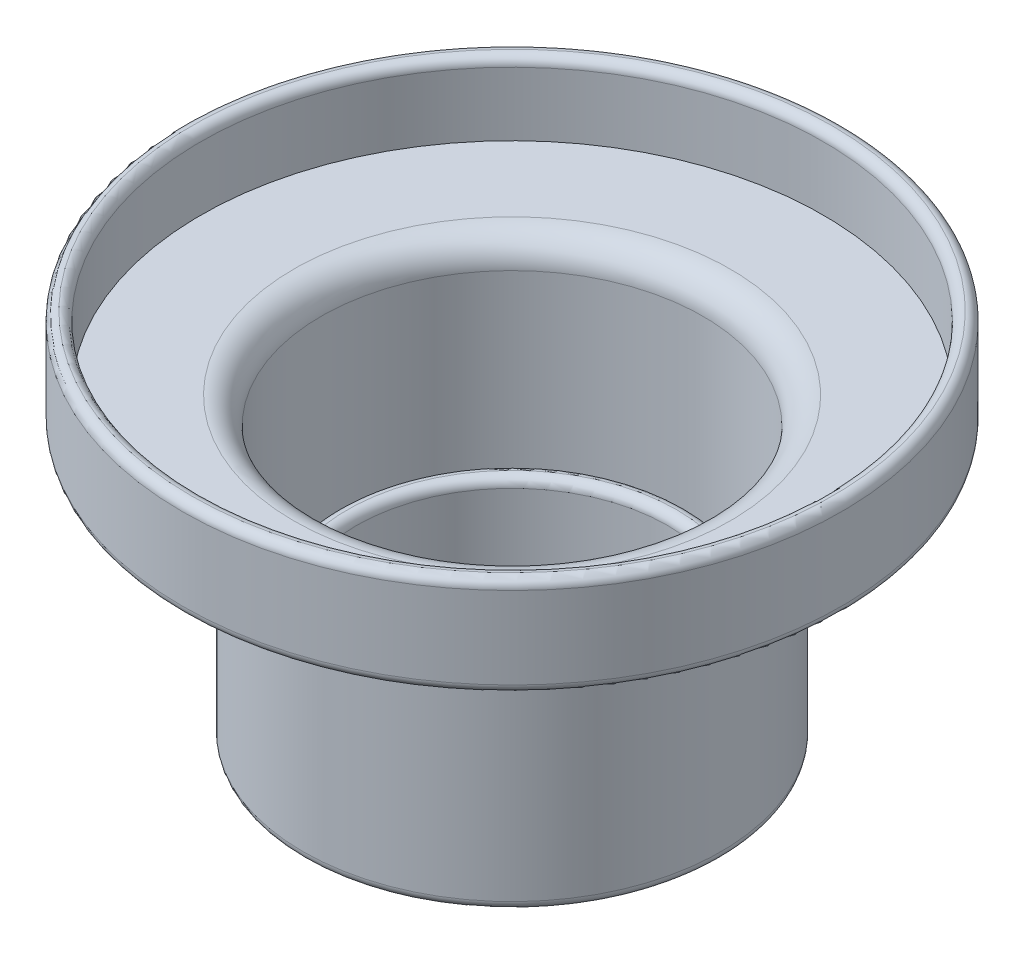
from build123d import *

# Parameters (mm, degrees)
SKETCH1_R           = 19.125
SKETCH1_R_2         = 17.125
BOSS_EXTRUDE1_DEPTH = 10
SKETCH2_R           = 23
SKETCH2_R_2         = 21
BOSS_EXTRUDE2_DEPTH = 30
BOSS_EXTRUDE3_START = -3
SKETCH3_R           = 23
SKETCH3_R_2         = 17.125
BOSS_EXTRUDE3_DEPTH = 3
BOSS_EXTRUDE4_START = -3
SKETCH4_R           = 36.25
SKETCH4_R_2         = 21
BOSS_EXTRUDE4_DEPTH = 3
SKETCH5_R           = 36.25
SKETCH5_R_2         = 34.25
BOSS_EXTRUDE5_DEPTH = 8
FILLET1_R           = 5
FILLET2_R           = 3
FILLET3_R           = 1


with BuildPart() as part:
    # Sketch1 → Boss-Extrude1 (new body)
    with BuildSketch(Plane(origin=(0, 0, 0), x_dir=(1, 0, 0), z_dir=(0, 1, 0))):
        with Locations(Location((0, 0, 0), (0, 0, 270))):
            Circle(SKETCH1_R)
        with Locations(Location((0, 0, 0), (0, 0, 270))):
            Circle(SKETCH1_R_2, mode=Mode.SUBTRACT)
    extrude(amount=BOSS_EXTRUDE1_DEPTH)



with BuildPart() as body_2:
    # Sketch2 → Boss-Extrude2 (new body)
    with BuildSketch(Plane(origin=(0, 0, 0), x_dir=(1, 0, 0), z_dir=(0, 1, 0))):
        with Locations(Location((0, 0, 0), (0, 0, 270))):
            Circle(SKETCH2_R)
        with Locations(Location((0, 0, 0), (0, 0, 270))):
            Circle(SKETCH2_R_2, mode=Mode.SUBTRACT)
    extrude(amount=BOSS_EXTRUDE2_DEPTH)


with BuildPart() as part_1:
    add(part.part)

    add(body_2.part)  # Boss-Extrude3 merges body 2
    # Sketch3 → Boss-Extrude3 (add)
    with BuildSketch(Plane(origin=(0, 0, 0), x_dir=(1, 0, 0), z_dir=(0, 1, 0)).offset(BOSS_EXTRUDE3_START)):
        with Locations(Location((0, 0, 0), (0, 0, 270))):
            Circle(SKETCH3_R)
        with Locations(Location((0, 0, 0), (0, 0, 270))):
            Circle(SKETCH3_R_2, mode=Mode.SUBTRACT)
    extrude(amount=BOSS_EXTRUDE3_DEPTH)

    # Sketch4 → Boss-Extrude4 (add)
    with BuildSketch(Plane(origin=(0, 30, 0), x_dir=(1, 0, 0), z_dir=(0, 1, 0)).offset(BOSS_EXTRUDE4_START)):
        with Locations(Location((0, 0, 0), (0, 0, 270))):
            Circle(SKETCH4_R)
        with Locations(Location((0, 0, 0), (0, 0, 270))):
            Circle(SKETCH4_R_2, mode=Mode.SUBTRACT)
    extrude(amount=BOSS_EXTRUDE4_DEPTH)

    # Sketch5 → Boss-Extrude5 (add)
    with BuildSketch(Plane(origin=(0, 30, 0), x_dir=(1, 0, 0), z_dir=(0, 1, 0))):
        with Locations(Location((0, 0, 0), (0, 0, 270))):
            Circle(SKETCH5_R)
        with Locations(Location((0, 0, 0), (0, 0, 270))):
            Circle(SKETCH5_R_2, mode=Mode.SUBTRACT)
    extrude(amount=BOSS_EXTRUDE5_DEPTH)

    # Fillet1
    fillet1_edges = [part_1.edges().sort_by_distance(p)[0] for p in [
        (0, 27, -23),
    ]]
    fillet(fillet1_edges, radius=FILLET1_R)

    # Fillet2
    fillet2_edges = [part_1.edges().sort_by_distance(p)[0] for p in [
        (0, 30, -21),
    ]]
    fillet(fillet2_edges, radius=FILLET2_R)

    # Fillet3
    fillet3_edges = [part_1.edges().sort_by_distance(p)[0] for p in [
        (0, 10, -19.125),
        (0, -3, -23),
        (0, -3, -17.125),
        (0, 27, -36.25),
        (0, 38, -34.25),
        (0, 38, -36.25),
        (0, 10, -17.125),
    ]]
    fillet(fillet3_edges, radius=FILLET3_R - 0.0001)  # a hair under: the kernel refuses the full size


solid = part_1.part
